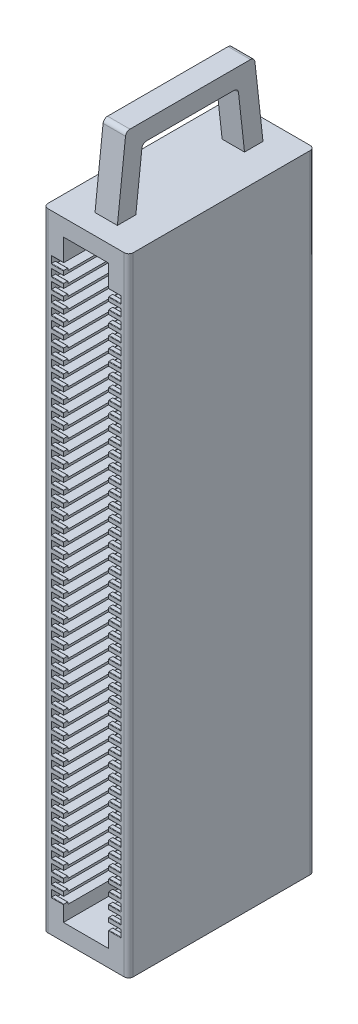
from build123d import *

# Parameters (mm, degrees)
SKETCH2_W              = 38.1
SKETCH2_H              = 83
BOSS_EXTRUDE1_DEPTH    = 140
SKETCH3_W              = 20.2
SKETCH3_H              = 265
CUT_EXTRUDE1_DEPTH     = 80.5
SKETCH4_W              = 5.43
SKETCH4_H              = 3
CUT_EXTRUDE2_DEPTH     = 80.5
SKETCH5_W              = 78.5
SKETCH5_H              = 1
CUT_EXTRUDE3_DEPTH     = 5.43
FILLET1_R              = 0.2
LPATTERN2_COUNT        = 50
LPATTERN2_PITCH        = 5
FILLET1_OF_LPATTERN2_R = 0.2
MIRROR1_START          = -15.53
MIRROR1_DEPTH          = 5.43
BOSS_EXTRUDE2_DEPTH    = 5
FILLET2_R              = 2
FILLET3_R              = 2


# Read off the part's stored shape, not the designer's step: Mirror1
with BuildPart() as part:
    # Sketch2 → Boss-Extrude1 (new, symmetric)
    with BuildSketch(Plane(origin=(0, 0, 0), x_dir=(1, 0, 0), z_dir=(0, 1, 0))):
        Rectangle(SKETCH2_W, SKETCH2_H)
    extrude(amount=BOSS_EXTRUDE1_DEPTH, both=True)

    # Sketch3 → Cut-Extrude1 (cut)
    with BuildSketch(Plane.XY.offset(41.5)):
        Rectangle(SKETCH3_W, SKETCH3_H)
    extrude(amount=-CUT_EXTRUDE1_DEPTH, mode=Mode.SUBTRACT)

    # Sketch4 → Cut-Extrude2 (cut)
    with BuildSketch(Plane.XY.offset(41.5)):
        with Locations((12.815, -124)):
            Rectangle(SKETCH4_W, SKETCH4_H)
    cut_extrude2 = extrude(amount=-CUT_EXTRUDE2_DEPTH, mode=Mode.SUBTRACT)

    # Sketch5 → Cut-Extrude3 (cut)
    with BuildSketch(Plane.ZY.offset(-10.1)):
        with Locations((0.25, -126)):
            Rectangle(SKETCH5_W, SKETCH5_H)
    cut_extrude3 = extrude(amount=-CUT_EXTRUDE3_DEPTH, mode=Mode.SUBTRACT)

    # Fillet1
    fillet1_edges = [part.edges().sort_by_distance(p)[0] for p in [
        (12.815, -125.5, 41.5),
        (12.815, -122.5, 41.5),
        (12.815, -125.5, 39.5),
    ]]
    fillet(fillet1_edges, radius=FILLET1_R)

    # LPattern2: Cut-Extrude2, Cut-Extrude3 ×50
    with Locations(*[(0, i * LPATTERN2_PITCH, 0) for i in range(1, LPATTERN2_COUNT)]):
        add(cut_extrude2, mode=Mode.SUBTRACT)
        add(cut_extrude3, mode=Mode.SUBTRACT)

    # Fillet1 of LPattern2
    fillet1_of_lpattern2_edges = [part.edges().sort_by_distance(p)[0] for p in [
        (12.815, -120.5, 41.5),
        (12.815, -117.5, 41.5),
        (12.815, -120.5, 39.5),
        (12.815, -115.5, 41.5),
        (12.815, -112.5, 41.5),
        (12.815, -115.5, 39.5),
        (12.815, -110.5, 41.5),
        (12.815, -107.5, 41.5),
        (12.815, -110.5, 39.5),
        (12.815, -105.5, 41.5),
        (12.815, -102.5, 41.5),
        (12.815, -105.5, 39.5),
        (12.815, -100.5, 41.5),
        (12.815, -97.5, 41.5),
        (12.815, -100.5, 39.5),
        (12.815, -95.5, 41.5),
        (12.815, -92.5, 41.5),
        (12.815, -95.5, 39.5),
        (12.815, -90.5, 41.5),
        (12.815, -87.5, 41.5),
        (12.815, -90.5, 39.5),
        (12.815, -85.5, 41.5),
        (12.815, -82.5, 41.5),
        (12.815, -85.5, 39.5),
        (12.815, -80.5, 41.5),
        (12.815, -77.5, 41.5),
        (12.815, -80.5, 39.5),
        (12.815, -75.5, 41.5),
        (12.815, -72.5, 41.5),
        (12.815, -75.5, 39.5),
        (12.815, -70.5, 41.5),
        (12.815, -67.5, 41.5),
        (12.815, -70.5, 39.5),
        (12.815, -65.5, 41.5),
        (12.815, -62.5, 41.5),
        (12.815, -65.5, 39.5),
        (12.815, -60.5, 41.5),
        (12.815, -57.5, 41.5),
        (12.815, -60.5, 39.5),
        (12.815, -55.5, 41.5),
        (12.815, -52.5, 41.5),
        (12.815, -55.5, 39.5),
        (12.815, -50.5, 41.5),
        (12.815, -47.5, 41.5),
        (12.815, -50.5, 39.5),
        (12.815, -45.5, 41.5),
        (12.815, -42.5, 41.5),
        (12.815, -45.5, 39.5),
        (12.815, -40.5, 41.5),
        (12.815, -37.5, 41.5),
        (12.815, -40.5, 39.5),
        (12.815, -35.5, 41.5),
        (12.815, -32.5, 41.5),
        (12.815, -35.5, 39.5),
        (12.815, -30.5, 41.5),
        (12.815, -27.5, 41.5),
        (12.815, -30.5, 39.5),
        (12.815, -25.5, 41.5),
        (12.815, -22.5, 41.5),
        (12.815, -25.5, 39.5),
        (12.815, -20.5, 41.5),
        (12.815, -17.5, 41.5),
        (12.815, -20.5, 39.5),
        (12.815, -15.5, 41.5),
        (12.815, -12.5, 41.5),
        (12.815, -15.5, 39.5),
        (12.815, -10.5, 41.5),
        (12.815, -7.5, 41.5),
        (12.815, -10.5, 39.5),
        (12.815, -5.5, 41.5),
        (12.815, -2.5, 41.5),
        (12.815, -5.5, 39.5),
        (12.815, -0.5, 41.5),
        (12.815, 2.5, 41.5),
        (12.815, -0.5, 39.5),
        (12.815, 4.5, 41.5),
        (12.815, 7.5, 41.5),
        (12.815, 4.5, 39.5),
        (12.815, 9.5, 41.5),
        (12.815, 12.5, 41.5),
        (12.815, 9.5, 39.5),
        (12.815, 14.5, 41.5),
        (12.815, 17.5, 41.5),
        (12.815, 14.5, 39.5),
        (12.815, 19.5, 41.5),
        (12.815, 22.5, 41.5),
        (12.815, 19.5, 39.5),
        (12.815, 24.5, 41.5),
        (12.815, 27.5, 41.5),
        (12.815, 24.5, 39.5),
        (12.815, 29.5, 41.5),
        (12.815, 32.5, 41.5),
        (12.815, 29.5, 39.5),
        (12.815, 34.5, 41.5),
        (12.815, 37.5, 41.5),
        (12.815, 34.5, 39.5),
        (12.815, 39.5, 41.5),
        (12.815, 42.5, 41.5),
        (12.815, 39.5, 39.5),
        (12.815, 44.5, 41.5),
        (12.815, 47.5, 41.5),
        (12.815, 44.5, 39.5),
        (12.815, 49.5, 41.5),
        (12.815, 52.5, 41.5),
        (12.815, 49.5, 39.5),
        (12.815, 54.5, 41.5),
        (12.815, 57.5, 41.5),
        (12.815, 54.5, 39.5),
        (12.815, 59.5, 41.5),
        (12.815, 62.5, 41.5),
        (12.815, 59.5, 39.5),
        (12.815, 64.5, 41.5),
        (12.815, 67.5, 41.5),
        (12.815, 64.5, 39.5),
        (12.815, 69.5, 41.5),
        (12.815, 72.5, 41.5),
        (12.815, 69.5, 39.5),
        (12.815, 74.5, 41.5),
        (12.815, 77.5, 41.5),
        (12.815, 74.5, 39.5),
        (12.815, 79.5, 41.5),
        (12.815, 82.5, 41.5),
        (12.815, 79.5, 39.5),
        (12.815, 84.5, 41.5),
        (12.815, 87.5, 41.5),
        (12.815, 84.5, 39.5),
        (12.815, 89.5, 41.5),
        (12.815, 92.5, 41.5),
        (12.815, 89.5, 39.5),
        (12.815, 94.5, 41.5),
        (12.815, 97.5, 41.5),
        (12.815, 94.5, 39.5),
        (12.815, 99.5, 41.5),
        (12.815, 102.5, 41.5),
        (12.815, 99.5, 39.5),
        (12.815, 104.5, 41.5),
        (12.815, 107.5, 41.5),
        (12.815, 104.5, 39.5),
        (12.815, 109.5, 41.5),
        (12.815, 112.5, 41.5),
        (12.815, 109.5, 39.5),
        (12.815, 114.5, 41.5),
        (12.815, 117.5, 41.5),
        (12.815, 114.5, 39.5),
        (12.815, 119.5, 41.5),
        (12.815, 122.5, 41.5),
        (12.815, 119.5, 39.5),
    ]]
    fillet(fillet1_of_lpattern2_edges, radius=FILLET1_OF_LPATTERN2_R)

    # Mirror1 outline → Mirror1 (cut)
    with BuildSketch(Plane.YZ.offset(MIRROR1_START)):
        with BuildLine():
            Line((119.5, 41.3), (119.5, 39.7))
            ThreePointArc((119.5, 39.7), (119.441421356, 39.558578644), (119.3, 39.5))
            Line((119.3, 39.5), (118.5, 39.5))
            Line((118.5, 39.5), (118.5, -39))
            Line((118.5, -39), (122.5, -39))
            Line((122.5, -39), (122.5, 41.3))
            ThreePointArc((122.5, 41.3), (122.558578644, 41.441421356), (122.7, 41.5))
            Line((122.7, 41.5), (119.3, 41.5))
            ThreePointArc((119.3, 41.5), (119.441421356, 41.441421356), (119.5, 41.3))
        make_face()
        with BuildLine():
            ThreePointArc((117.5, 41.3), (117.558578644, 41.441421356), (117.7, 41.5))
            Line((117.7, 41.5), (114.3, 41.5))
            ThreePointArc((114.3, 41.5), (114.441421356, 41.441421356), (114.5, 41.3))
            Line((114.5, 41.3), (114.5, 39.7))
            ThreePointArc((114.5, 39.7), (114.441421356, 39.558578644), (114.3, 39.5))
            Line((114.3, 39.5), (113.5, 39.5))
            Line((113.5, 39.5), (113.5, -39))
            Line((113.5, -39), (117.5, -39))
            Line((117.5, -39), (117.5, 41.3))
        make_face()
        with BuildLine():
            ThreePointArc((112.5, 41.3), (112.558578644, 41.441421356), (112.7, 41.5))
            Line((112.7, 41.5), (109.3, 41.5))
            ThreePointArc((109.3, 41.5), (109.441421356, 41.441421356), (109.5, 41.3))
            Line((109.5, 41.3), (109.5, 39.7))
            ThreePointArc((109.5, 39.7), (109.441421356, 39.558578644), (109.3, 39.5))
            Line((109.3, 39.5), (108.5, 39.5))
            Line((108.5, 39.5), (108.5, -39))
            Line((108.5, -39), (112.5, -39))
            Line((112.5, -39), (112.5, 41.3))
        make_face()
        with BuildLine():
            ThreePointArc((107.5, 41.3), (107.558578644, 41.441421356), (107.7, 41.5))
            Line((107.7, 41.5), (104.3, 41.5))
            ThreePointArc((104.3, 41.5), (104.441421356, 41.441421356), (104.5, 41.3))
            Line((104.5, 41.3), (104.5, 39.7))
            ThreePointArc((104.5, 39.7), (104.441421356, 39.558578644), (104.3, 39.5))
            Line((104.3, 39.5), (103.5, 39.5))
            Line((103.5, 39.5), (103.5, -39))
            Line((103.5, -39), (107.5, -39))
            Line((107.5, -39), (107.5, 41.3))
        make_face()
        with BuildLine():
            ThreePointArc((102.5, 41.3), (102.558578644, 41.441421356), (102.7, 41.5))
            Line((102.7, 41.5), (99.3, 41.5))
            ThreePointArc((99.3, 41.5), (99.441421356, 41.441421356), (99.5, 41.3))
            Line((99.5, 41.3), (99.5, 39.7))
            ThreePointArc((99.5, 39.7), (99.441421356, 39.558578644), (99.3, 39.5))
            Line((99.3, 39.5), (98.5, 39.5))
            Line((98.5, 39.5), (98.5, -39))
            Line((98.5, -39), (102.5, -39))
            Line((102.5, -39), (102.5, 41.3))
        make_face()
        with BuildLine():
            ThreePointArc((97.5, 41.3), (97.558578644, 41.441421356), (97.7, 41.5))
            Line((97.7, 41.5), (94.3, 41.5))
            ThreePointArc((94.3, 41.5), (94.441421356, 41.441421356), (94.5, 41.3))
            Line((94.5, 41.3), (94.5, 39.7))
            ThreePointArc((94.5, 39.7), (94.441421356, 39.558578644), (94.3, 39.5))
            Line((94.3, 39.5), (93.5, 39.5))
            Line((93.5, 39.5), (93.5, -39))
            Line((93.5, -39), (97.5, -39))
            Line((97.5, -39), (97.5, 41.3))
        make_face()
        with BuildLine():
            ThreePointArc((92.5, 41.3), (92.558578644, 41.441421356), (92.7, 41.5))
            Line((92.7, 41.5), (89.3, 41.5))
            ThreePointArc((89.3, 41.5), (89.441421356, 41.441421356), (89.5, 41.3))
            Line((89.5, 41.3), (89.5, 39.7))
            ThreePointArc((89.5, 39.7), (89.441421356, 39.558578644), (89.3, 39.5))
            Line((89.3, 39.5), (88.5, 39.5))
            Line((88.5, 39.5), (88.5, -39))
            Line((88.5, -39), (92.5, -39))
            Line((92.5, -39), (92.5, 41.3))
        make_face()
        with BuildLine():
            ThreePointArc((87.5, 41.3), (87.558578644, 41.441421356), (87.7, 41.5))
            Line((87.7, 41.5), (84.3, 41.5))
            ThreePointArc((84.3, 41.5), (84.441421356, 41.441421356), (84.5, 41.3))
            Line((84.5, 41.3), (84.5, 39.7))
            ThreePointArc((84.5, 39.7), (84.441421356, 39.558578644), (84.3, 39.5))
            Line((84.3, 39.5), (83.5, 39.5))
            Line((83.5, 39.5), (83.5, -39))
            Line((83.5, -39), (87.5, -39))
            Line((87.5, -39), (87.5, 41.3))
        make_face()
        with BuildLine():
            ThreePointArc((82.5, 41.3), (82.558578644, 41.441421356), (82.7, 41.5))
            Line((82.7, 41.5), (79.3, 41.5))
            ThreePointArc((79.3, 41.5), (79.441421356, 41.441421356), (79.5, 41.3))
            Line((79.5, 41.3), (79.5, 39.7))
            ThreePointArc((79.5, 39.7), (79.441421356, 39.558578644), (79.3, 39.5))
            Line((79.3, 39.5), (78.5, 39.5))
            Line((78.5, 39.5), (78.5, -39))
            Line((78.5, -39), (82.5, -39))
            Line((82.5, -39), (82.5, 41.3))
        make_face()
        with BuildLine():
            ThreePointArc((77.5, 41.3), (77.558578644, 41.441421356), (77.7, 41.5))
            Line((77.7, 41.5), (74.3, 41.5))
            ThreePointArc((74.3, 41.5), (74.441421356, 41.441421356), (74.5, 41.3))
            Line((74.5, 41.3), (74.5, 39.7))
            ThreePointArc((74.5, 39.7), (74.441421356, 39.558578644), (74.3, 39.5))
            Line((74.3, 39.5), (73.5, 39.5))
            Line((73.5, 39.5), (73.5, -39))
            Line((73.5, -39), (77.5, -39))
            Line((77.5, -39), (77.5, 41.3))
        make_face()
        with BuildLine():
            ThreePointArc((72.5, 41.3), (72.558578644, 41.441421356), (72.7, 41.5))
            Line((72.7, 41.5), (69.3, 41.5))
            ThreePointArc((69.3, 41.5), (69.441421356, 41.441421356), (69.5, 41.3))
            Line((69.5, 41.3), (69.5, 39.7))
            ThreePointArc((69.5, 39.7), (69.441421356, 39.558578644), (69.3, 39.5))
            Line((69.3, 39.5), (68.5, 39.5))
            Line((68.5, 39.5), (68.5, -39))
            Line((68.5, -39), (72.5, -39))
            Line((72.5, -39), (72.5, 41.3))
        make_face()
        with BuildLine():
            ThreePointArc((67.5, 41.3), (67.558578644, 41.441421356), (67.7, 41.5))
            Line((67.7, 41.5), (64.3, 41.5))
            ThreePointArc((64.3, 41.5), (64.441421356, 41.441421356), (64.5, 41.3))
            Line((64.5, 41.3), (64.5, 39.7))
            ThreePointArc((64.5, 39.7), (64.441421356, 39.558578644), (64.3, 39.5))
            Line((64.3, 39.5), (63.5, 39.5))
            Line((63.5, 39.5), (63.5, -39))
            Line((63.5, -39), (67.5, -39))
            Line((67.5, -39), (67.5, 41.3))
        make_face()
        with BuildLine():
            ThreePointArc((62.5, 41.3), (62.558578644, 41.441421356), (62.7, 41.5))
            Line((62.7, 41.5), (59.3, 41.5))
            ThreePointArc((59.3, 41.5), (59.441421356, 41.441421356), (59.5, 41.3))
            Line((59.5, 41.3), (59.5, 39.7))
            ThreePointArc((59.5, 39.7), (59.441421356, 39.558578644), (59.3, 39.5))
            Line((59.3, 39.5), (58.5, 39.5))
            Line((58.5, 39.5), (58.5, -39))
            Line((58.5, -39), (62.5, -39))
            Line((62.5, -39), (62.5, 41.3))
        make_face()
        with BuildLine():
            ThreePointArc((57.5, 41.3), (57.558578644, 41.441421356), (57.7, 41.5))
            Line((57.7, 41.5), (54.3, 41.5))
            ThreePointArc((54.3, 41.5), (54.441421356, 41.441421356), (54.5, 41.3))
            Line((54.5, 41.3), (54.5, 39.7))
            ThreePointArc((54.5, 39.7), (54.441421356, 39.558578644), (54.3, 39.5))
            Line((54.3, 39.5), (53.5, 39.5))
            Line((53.5, 39.5), (53.5, -39))
            Line((53.5, -39), (57.5, -39))
            Line((57.5, -39), (57.5, 41.3))
        make_face()
        with BuildLine():
            ThreePointArc((52.5, 41.3), (52.558578644, 41.441421356), (52.7, 41.5))
            Line((52.7, 41.5), (49.3, 41.5))
            ThreePointArc((49.3, 41.5), (49.441421356, 41.441421356), (49.5, 41.3))
            Line((49.5, 41.3), (49.5, 39.7))
            ThreePointArc((49.5, 39.7), (49.441421356, 39.558578644), (49.3, 39.5))
            Line((49.3, 39.5), (48.5, 39.5))
            Line((48.5, 39.5), (48.5, -39))
            Line((48.5, -39), (52.5, -39))
            Line((52.5, -39), (52.5, 41.3))
        make_face()
        with BuildLine():
            ThreePointArc((47.5, 41.3), (47.558578644, 41.441421356), (47.7, 41.5))
            Line((47.7, 41.5), (44.3, 41.5))
            ThreePointArc((44.3, 41.5), (44.441421356, 41.441421356), (44.5, 41.3))
            Line((44.5, 41.3), (44.5, 39.7))
            ThreePointArc((44.5, 39.7), (44.441421356, 39.558578644), (44.3, 39.5))
            Line((44.3, 39.5), (43.5, 39.5))
            Line((43.5, 39.5), (43.5, -39))
            Line((43.5, -39), (47.5, -39))
            Line((47.5, -39), (47.5, 41.3))
        make_face()
        with BuildLine():
            ThreePointArc((42.5, 41.3), (42.558578644, 41.441421356), (42.7, 41.5))
            Line((42.7, 41.5), (39.3, 41.5))
            ThreePointArc((39.3, 41.5), (39.441421356, 41.441421356), (39.5, 41.3))
            Line((39.5, 41.3), (39.5, 39.7))
            ThreePointArc((39.5, 39.7), (39.441421356, 39.558578644), (39.3, 39.5))
            Line((39.3, 39.5), (38.5, 39.5))
            Line((38.5, 39.5), (38.5, -39))
            Line((38.5, -39), (42.5, -39))
            Line((42.5, -39), (42.5, 41.3))
        make_face()
        with BuildLine():
            ThreePointArc((37.5, 41.3), (37.558578644, 41.441421356), (37.7, 41.5))
            Line((37.7, 41.5), (34.3, 41.5))
            ThreePointArc((34.3, 41.5), (34.441421356, 41.441421356), (34.5, 41.3))
            Line((34.5, 41.3), (34.5, 39.7))
            ThreePointArc((34.5, 39.7), (34.441421356, 39.558578644), (34.3, 39.5))
            Line((34.3, 39.5), (33.5, 39.5))
            Line((33.5, 39.5), (33.5, -39))
            Line((33.5, -39), (37.5, -39))
            Line((37.5, -39), (37.5, 41.3))
        make_face()
        with BuildLine():
            ThreePointArc((32.5, 41.3), (32.558578644, 41.441421356), (32.7, 41.5))
            Line((32.7, 41.5), (29.3, 41.5))
            ThreePointArc((29.3, 41.5), (29.441421356, 41.441421356), (29.5, 41.3))
            Line((29.5, 41.3), (29.5, 39.7))
            ThreePointArc((29.5, 39.7), (29.441421356, 39.558578644), (29.3, 39.5))
            Line((29.3, 39.5), (28.5, 39.5))
            Line((28.5, 39.5), (28.5, -39))
            Line((28.5, -39), (32.5, -39))
            Line((32.5, -39), (32.5, 41.3))
        make_face()
        with BuildLine():
            ThreePointArc((27.5, 41.3), (27.558578644, 41.441421356), (27.7, 41.5))
            Line((27.7, 41.5), (24.3, 41.5))
            ThreePointArc((24.3, 41.5), (24.441421356, 41.441421356), (24.5, 41.3))
            Line((24.5, 41.3), (24.5, 39.7))
            ThreePointArc((24.5, 39.7), (24.441421356, 39.558578644), (24.3, 39.5))
            Line((24.3, 39.5), (23.5, 39.5))
            Line((23.5, 39.5), (23.5, -39))
            Line((23.5, -39), (27.5, -39))
            Line((27.5, -39), (27.5, 41.3))
        make_face()
        with BuildLine():
            ThreePointArc((22.5, 41.3), (22.558578644, 41.441421356), (22.7, 41.5))
            Line((22.7, 41.5), (19.3, 41.5))
            ThreePointArc((19.3, 41.5), (19.441421356, 41.441421356), (19.5, 41.3))
            Line((19.5, 41.3), (19.5, 39.7))
            ThreePointArc((19.5, 39.7), (19.441421356, 39.558578644), (19.3, 39.5))
            Line((19.3, 39.5), (18.5, 39.5))
            Line((18.5, 39.5), (18.5, -39))
            Line((18.5, -39), (22.5, -39))
            Line((22.5, -39), (22.5, 41.3))
        make_face()
        with BuildLine():
            ThreePointArc((17.5, 41.3), (17.558578644, 41.441421356), (17.7, 41.5))
            Line((17.7, 41.5), (14.3, 41.5))
            ThreePointArc((14.3, 41.5), (14.441421356, 41.441421356), (14.5, 41.3))
            Line((14.5, 41.3), (14.5, 39.7))
            ThreePointArc((14.5, 39.7), (14.441421356, 39.558578644), (14.3, 39.5))
            Line((14.3, 39.5), (13.5, 39.5))
            Line((13.5, 39.5), (13.5, -39))
            Line((13.5, -39), (17.5, -39))
            Line((17.5, -39), (17.5, 41.3))
        make_face()
        with BuildLine():
            ThreePointArc((12.5, 41.3), (12.558578644, 41.441421356), (12.7, 41.5))
            Line((12.7, 41.5), (9.3, 41.5))
            ThreePointArc((9.3, 41.5), (9.441421356, 41.441421356), (9.5, 41.3))
            Line((9.5, 41.3), (9.5, 39.7))
            ThreePointArc((9.5, 39.7), (9.441421356, 39.558578644), (9.3, 39.5))
            Line((9.3, 39.5), (8.5, 39.5))
            Line((8.5, 39.5), (8.5, -39))
            Line((8.5, -39), (12.5, -39))
            Line((12.5, -39), (12.5, 41.3))
        make_face()
        with BuildLine():
            ThreePointArc((7.5, 41.3), (7.558578644, 41.441421356), (7.7, 41.5))
            Line((7.7, 41.5), (4.3, 41.5))
            ThreePointArc((4.3, 41.5), (4.441421356, 41.441421356), (4.5, 41.3))
            Line((4.5, 41.3), (4.5, 39.7))
            ThreePointArc((4.5, 39.7), (4.441421356, 39.558578644), (4.3, 39.5))
            Line((4.3, 39.5), (3.5, 39.5))
            Line((3.5, 39.5), (3.5, -39))
            Line((3.5, -39), (7.5, -39))
            Line((7.5, -39), (7.5, 41.3))
        make_face()
        with BuildLine():
            ThreePointArc((2.5, 41.3), (2.558578644, 41.441421356), (2.7, 41.5))
            Line((2.7, 41.5), (-0.7, 41.5))
            ThreePointArc((-0.7, 41.5), (-0.558578644, 41.441421356), (-0.5, 41.3))
            Line((-0.5, 41.3), (-0.5, 39.7))
            ThreePointArc((-0.5, 39.7), (-0.558578644, 39.558578644), (-0.7, 39.5))
            Line((-0.7, 39.5), (-1.5, 39.5))
            Line((-1.5, 39.5), (-1.5, -39))
            Line((-1.5, -39), (2.5, -39))
            Line((2.5, -39), (2.5, 41.3))
        make_face()
        with BuildLine():
            ThreePointArc((-2.5, 41.3), (-2.441421356, 41.441421356), (-2.3, 41.5))
            Line((-2.3, 41.5), (-5.7, 41.5))
            ThreePointArc((-5.7, 41.5), (-5.558578644, 41.441421356), (-5.5, 41.3))
            Line((-5.5, 41.3), (-5.5, 39.7))
            ThreePointArc((-5.5, 39.7), (-5.558578644, 39.558578644), (-5.7, 39.5))
            Line((-5.7, 39.5), (-6.5, 39.5))
            Line((-6.5, 39.5), (-6.5, -39))
            Line((-6.5, -39), (-2.5, -39))
            Line((-2.5, -39), (-2.5, 41.3))
        make_face()
        with BuildLine():
            ThreePointArc((-7.5, 41.3), (-7.441421356, 41.441421356), (-7.3, 41.5))
            Line((-7.3, 41.5), (-10.7, 41.5))
            ThreePointArc((-10.7, 41.5), (-10.558578644, 41.441421356), (-10.5, 41.3))
            Line((-10.5, 41.3), (-10.5, 39.7))
            ThreePointArc((-10.5, 39.7), (-10.558578644, 39.558578644), (-10.7, 39.5))
            Line((-10.7, 39.5), (-11.5, 39.5))
            Line((-11.5, 39.5), (-11.5, -39))
            Line((-11.5, -39), (-7.5, -39))
            Line((-7.5, -39), (-7.5, 41.3))
        make_face()
        with BuildLine():
            ThreePointArc((-12.5, 41.3), (-12.441421356, 41.441421356), (-12.3, 41.5))
            Line((-12.3, 41.5), (-15.7, 41.5))
            ThreePointArc((-15.7, 41.5), (-15.558578644, 41.441421356), (-15.5, 41.3))
            Line((-15.5, 41.3), (-15.5, 39.7))
            ThreePointArc((-15.5, 39.7), (-15.558578644, 39.558578644), (-15.7, 39.5))
            Line((-15.7, 39.5), (-16.5, 39.5))
            Line((-16.5, 39.5), (-16.5, -39))
            Line((-16.5, -39), (-12.5, -39))
            Line((-12.5, -39), (-12.5, 41.3))
        make_face()
        with BuildLine():
            ThreePointArc((-17.5, 41.3), (-17.441421356, 41.441421356), (-17.3, 41.5))
            Line((-17.3, 41.5), (-20.7, 41.5))
            ThreePointArc((-20.7, 41.5), (-20.558578644, 41.441421356), (-20.5, 41.3))
            Line((-20.5, 41.3), (-20.5, 39.7))
            ThreePointArc((-20.5, 39.7), (-20.558578644, 39.558578644), (-20.7, 39.5))
            Line((-20.7, 39.5), (-21.5, 39.5))
            Line((-21.5, 39.5), (-21.5, -39))
            Line((-21.5, -39), (-17.5, -39))
            Line((-17.5, -39), (-17.5, 41.3))
        make_face()
        with BuildLine():
            ThreePointArc((-22.5, 41.3), (-22.441421356, 41.441421356), (-22.3, 41.5))
            Line((-22.3, 41.5), (-25.7, 41.5))
            ThreePointArc((-25.7, 41.5), (-25.558578644, 41.441421356), (-25.5, 41.3))
            Line((-25.5, 41.3), (-25.5, 39.7))
            ThreePointArc((-25.5, 39.7), (-25.558578644, 39.558578644), (-25.7, 39.5))
            Line((-25.7, 39.5), (-26.5, 39.5))
            Line((-26.5, 39.5), (-26.5, -39))
            Line((-26.5, -39), (-22.5, -39))
            Line((-22.5, -39), (-22.5, 41.3))
        make_face()
        with BuildLine():
            ThreePointArc((-27.5, 41.3), (-27.441421356, 41.441421356), (-27.3, 41.5))
            Line((-27.3, 41.5), (-30.7, 41.5))
            ThreePointArc((-30.7, 41.5), (-30.558578644, 41.441421356), (-30.5, 41.3))
            Line((-30.5, 41.3), (-30.5, 39.7))
            ThreePointArc((-30.5, 39.7), (-30.558578644, 39.558578644), (-30.7, 39.5))
            Line((-30.7, 39.5), (-31.5, 39.5))
            Line((-31.5, 39.5), (-31.5, -39))
            Line((-31.5, -39), (-27.5, -39))
            Line((-27.5, -39), (-27.5, 41.3))
        make_face()
        with BuildLine():
            ThreePointArc((-32.5, 41.3), (-32.441421356, 41.441421356), (-32.3, 41.5))
            Line((-32.3, 41.5), (-35.7, 41.5))
            ThreePointArc((-35.7, 41.5), (-35.558578644, 41.441421356), (-35.5, 41.3))
            Line((-35.5, 41.3), (-35.5, 39.7))
            ThreePointArc((-35.5, 39.7), (-35.558578644, 39.558578644), (-35.7, 39.5))
            Line((-35.7, 39.5), (-36.5, 39.5))
            Line((-36.5, 39.5), (-36.5, -39))
            Line((-36.5, -39), (-32.5, -39))
            Line((-32.5, -39), (-32.5, 41.3))
        make_face()
        with BuildLine():
            ThreePointArc((-37.5, 41.3), (-37.441421356, 41.441421356), (-37.3, 41.5))
            Line((-37.3, 41.5), (-40.7, 41.5))
            ThreePointArc((-40.7, 41.5), (-40.558578644, 41.441421356), (-40.5, 41.3))
            Line((-40.5, 41.3), (-40.5, 39.7))
            ThreePointArc((-40.5, 39.7), (-40.558578644, 39.558578644), (-40.7, 39.5))
            Line((-40.7, 39.5), (-41.5, 39.5))
            Line((-41.5, 39.5), (-41.5, -39))
            Line((-41.5, -39), (-37.5, -39))
            Line((-37.5, -39), (-37.5, 41.3))
        make_face()
        with BuildLine():
            ThreePointArc((-42.5, 41.3), (-42.441421356, 41.441421356), (-42.3, 41.5))
            Line((-42.3, 41.5), (-45.7, 41.5))
            ThreePointArc((-45.7, 41.5), (-45.558578644, 41.441421356), (-45.5, 41.3))
            Line((-45.5, 41.3), (-45.5, 39.7))
            ThreePointArc((-45.5, 39.7), (-45.558578644, 39.558578644), (-45.7, 39.5))
            Line((-45.7, 39.5), (-46.5, 39.5))
            Line((-46.5, 39.5), (-46.5, -39))
            Line((-46.5, -39), (-42.5, -39))
            Line((-42.5, -39), (-42.5, 41.3))
        make_face()
        with BuildLine():
            ThreePointArc((-47.5, 41.3), (-47.441421356, 41.441421356), (-47.3, 41.5))
            Line((-47.3, 41.5), (-50.7, 41.5))
            ThreePointArc((-50.7, 41.5), (-50.558578644, 41.441421356), (-50.5, 41.3))
            Line((-50.5, 41.3), (-50.5, 39.7))
            ThreePointArc((-50.5, 39.7), (-50.558578644, 39.558578644), (-50.7, 39.5))
            Line((-50.7, 39.5), (-51.5, 39.5))
            Line((-51.5, 39.5), (-51.5, -39))
            Line((-51.5, -39), (-47.5, -39))
            Line((-47.5, -39), (-47.5, 41.3))
        make_face()
        with BuildLine():
            ThreePointArc((-52.5, 41.3), (-52.441421356, 41.441421356), (-52.3, 41.5))
            Line((-52.3, 41.5), (-55.7, 41.5))
            ThreePointArc((-55.7, 41.5), (-55.558578644, 41.441421356), (-55.5, 41.3))
            Line((-55.5, 41.3), (-55.5, 39.7))
            ThreePointArc((-55.5, 39.7), (-55.558578644, 39.558578644), (-55.7, 39.5))
            Line((-55.7, 39.5), (-56.5, 39.5))
            Line((-56.5, 39.5), (-56.5, -39))
            Line((-56.5, -39), (-52.5, -39))
            Line((-52.5, -39), (-52.5, 41.3))
        make_face()
        with BuildLine():
            ThreePointArc((-57.5, 41.3), (-57.441421356, 41.441421356), (-57.3, 41.5))
            Line((-57.3, 41.5), (-60.7, 41.5))
            ThreePointArc((-60.7, 41.5), (-60.558578644, 41.441421356), (-60.5, 41.3))
            Line((-60.5, 41.3), (-60.5, 39.7))
            ThreePointArc((-60.5, 39.7), (-60.558578644, 39.558578644), (-60.7, 39.5))
            Line((-60.7, 39.5), (-61.5, 39.5))
            Line((-61.5, 39.5), (-61.5, -39))
            Line((-61.5, -39), (-57.5, -39))
            Line((-57.5, -39), (-57.5, 41.3))
        make_face()
        with BuildLine():
            ThreePointArc((-62.5, 41.3), (-62.441421356, 41.441421356), (-62.3, 41.5))
            Line((-62.3, 41.5), (-65.7, 41.5))
            ThreePointArc((-65.7, 41.5), (-65.558578644, 41.441421356), (-65.5, 41.3))
            Line((-65.5, 41.3), (-65.5, 39.7))
            ThreePointArc((-65.5, 39.7), (-65.558578644, 39.558578644), (-65.7, 39.5))
            Line((-65.7, 39.5), (-66.5, 39.5))
            Line((-66.5, 39.5), (-66.5, -39))
            Line((-66.5, -39), (-62.5, -39))
            Line((-62.5, -39), (-62.5, 41.3))
        make_face()
        with BuildLine():
            ThreePointArc((-67.5, 41.3), (-67.441421356, 41.441421356), (-67.3, 41.5))
            Line((-67.3, 41.5), (-70.7, 41.5))
            ThreePointArc((-70.7, 41.5), (-70.558578644, 41.441421356), (-70.5, 41.3))
            Line((-70.5, 41.3), (-70.5, 39.7))
            ThreePointArc((-70.5, 39.7), (-70.558578644, 39.558578644), (-70.7, 39.5))
            Line((-70.7, 39.5), (-71.5, 39.5))
            Line((-71.5, 39.5), (-71.5, -39))
            Line((-71.5, -39), (-67.5, -39))
            Line((-67.5, -39), (-67.5, 41.3))
        make_face()
        with BuildLine():
            ThreePointArc((-72.5, 41.3), (-72.441421356, 41.441421356), (-72.3, 41.5))
            Line((-72.3, 41.5), (-75.7, 41.5))
            ThreePointArc((-75.7, 41.5), (-75.558578644, 41.441421356), (-75.5, 41.3))
            Line((-75.5, 41.3), (-75.5, 39.7))
            ThreePointArc((-75.5, 39.7), (-75.558578644, 39.558578644), (-75.7, 39.5))
            Line((-75.7, 39.5), (-76.5, 39.5))
            Line((-76.5, 39.5), (-76.5, -39))
            Line((-76.5, -39), (-72.5, -39))
            Line((-72.5, -39), (-72.5, 41.3))
        make_face()
        with BuildLine():
            ThreePointArc((-77.5, 41.3), (-77.441421356, 41.441421356), (-77.3, 41.5))
            Line((-77.3, 41.5), (-80.7, 41.5))
            ThreePointArc((-80.7, 41.5), (-80.558578644, 41.441421356), (-80.5, 41.3))
            Line((-80.5, 41.3), (-80.5, 39.7))
            ThreePointArc((-80.5, 39.7), (-80.558578644, 39.558578644), (-80.7, 39.5))
            Line((-80.7, 39.5), (-81.5, 39.5))
            Line((-81.5, 39.5), (-81.5, -39))
            Line((-81.5, -39), (-77.5, -39))
            Line((-77.5, -39), (-77.5, 41.3))
        make_face()
        with BuildLine():
            ThreePointArc((-82.5, 41.3), (-82.441421356, 41.441421356), (-82.3, 41.5))
            Line((-82.3, 41.5), (-85.7, 41.5))
            ThreePointArc((-85.7, 41.5), (-85.558578644, 41.441421356), (-85.5, 41.3))
            Line((-85.5, 41.3), (-85.5, 39.7))
            ThreePointArc((-85.5, 39.7), (-85.558578644, 39.558578644), (-85.7, 39.5))
            Line((-85.7, 39.5), (-86.5, 39.5))
            Line((-86.5, 39.5), (-86.5, -39))
            Line((-86.5, -39), (-82.5, -39))
            Line((-82.5, -39), (-82.5, 41.3))
        make_face()
        with BuildLine():
            ThreePointArc((-87.5, 41.3), (-87.441421356, 41.441421356), (-87.3, 41.5))
            Line((-87.3, 41.5), (-90.7, 41.5))
            ThreePointArc((-90.7, 41.5), (-90.558578644, 41.441421356), (-90.5, 41.3))
            Line((-90.5, 41.3), (-90.5, 39.7))
            ThreePointArc((-90.5, 39.7), (-90.558578644, 39.558578644), (-90.7, 39.5))
            Line((-90.7, 39.5), (-91.5, 39.5))
            Line((-91.5, 39.5), (-91.5, -39))
            Line((-91.5, -39), (-87.5, -39))
            Line((-87.5, -39), (-87.5, 41.3))
        make_face()
        with BuildLine():
            ThreePointArc((-92.5, 41.3), (-92.441421356, 41.441421356), (-92.3, 41.5))
            Line((-92.3, 41.5), (-95.7, 41.5))
            ThreePointArc((-95.7, 41.5), (-95.558578644, 41.441421356), (-95.5, 41.3))
            Line((-95.5, 41.3), (-95.5, 39.7))
            ThreePointArc((-95.5, 39.7), (-95.558578644, 39.558578644), (-95.7, 39.5))
            Line((-95.7, 39.5), (-96.5, 39.5))
            Line((-96.5, 39.5), (-96.5, -39))
            Line((-96.5, -39), (-92.5, -39))
            Line((-92.5, -39), (-92.5, 41.3))
        make_face()
        with BuildLine():
            ThreePointArc((-97.5, 41.3), (-97.441421356, 41.441421356), (-97.3, 41.5))
            Line((-97.3, 41.5), (-100.7, 41.5))
            ThreePointArc((-100.7, 41.5), (-100.558578644, 41.441421356), (-100.5, 41.3))
            Line((-100.5, 41.3), (-100.5, 39.7))
            ThreePointArc((-100.5, 39.7), (-100.558578644, 39.558578644), (-100.7, 39.5))
            Line((-100.7, 39.5), (-101.5, 39.5))
            Line((-101.5, 39.5), (-101.5, -39))
            Line((-101.5, -39), (-97.5, -39))
            Line((-97.5, -39), (-97.5, 41.3))
        make_face()
        with BuildLine():
            ThreePointArc((-102.5, 41.3), (-102.441421356, 41.441421356), (-102.3, 41.5))
            Line((-102.3, 41.5), (-105.7, 41.5))
            ThreePointArc((-105.7, 41.5), (-105.558578644, 41.441421356), (-105.5, 41.3))
            Line((-105.5, 41.3), (-105.5, 39.7))
            ThreePointArc((-105.5, 39.7), (-105.558578644, 39.558578644), (-105.7, 39.5))
            Line((-105.7, 39.5), (-106.5, 39.5))
            Line((-106.5, 39.5), (-106.5, -39))
            Line((-106.5, -39), (-102.5, -39))
            Line((-102.5, -39), (-102.5, 41.3))
        make_face()
        with BuildLine():
            ThreePointArc((-107.5, 41.3), (-107.441421356, 41.441421356), (-107.3, 41.5))
            Line((-107.3, 41.5), (-110.7, 41.5))
            ThreePointArc((-110.7, 41.5), (-110.558578644, 41.441421356), (-110.5, 41.3))
            Line((-110.5, 41.3), (-110.5, 39.7))
            ThreePointArc((-110.5, 39.7), (-110.558578644, 39.558578644), (-110.7, 39.5))
            Line((-110.7, 39.5), (-111.5, 39.5))
            Line((-111.5, 39.5), (-111.5, -39))
            Line((-111.5, -39), (-107.5, -39))
            Line((-107.5, -39), (-107.5, 41.3))
        make_face()
        with BuildLine():
            ThreePointArc((-112.5, 41.3), (-112.441421356, 41.441421356), (-112.3, 41.5))
            Line((-112.3, 41.5), (-115.7, 41.5))
            ThreePointArc((-115.7, 41.5), (-115.558578644, 41.441421356), (-115.5, 41.3))
            Line((-115.5, 41.3), (-115.5, 39.7))
            ThreePointArc((-115.5, 39.7), (-115.558578644, 39.558578644), (-115.7, 39.5))
            Line((-115.7, 39.5), (-116.5, 39.5))
            Line((-116.5, 39.5), (-116.5, -39))
            Line((-116.5, -39), (-112.5, -39))
            Line((-112.5, -39), (-112.5, 41.3))
        make_face()
        with BuildLine():
            ThreePointArc((-117.5, 41.3), (-117.441421356, 41.441421356), (-117.3, 41.5))
            Line((-117.3, 41.5), (-120.7, 41.5))
            ThreePointArc((-120.7, 41.5), (-120.558578644, 41.441421356), (-120.5, 41.3))
            Line((-120.5, 41.3), (-120.5, 39.7))
            ThreePointArc((-120.5, 39.7), (-120.558578644, 39.558578644), (-120.7, 39.5))
            Line((-120.7, 39.5), (-121.5, 39.5))
            Line((-121.5, 39.5), (-121.5, -39))
            Line((-121.5, -39), (-117.5, -39))
            Line((-117.5, -39), (-117.5, 41.3))
        make_face()
        with BuildLine():
            ThreePointArc((-122.5, 41.3), (-122.441421356, 41.441421356), (-122.3, 41.5))
            Line((-122.3, 41.5), (-125.7, 41.5))
            ThreePointArc((-125.7, 41.5), (-125.558578644, 41.441421356), (-125.5, 41.3))
            Line((-125.5, 41.3), (-125.5, 39.7))
            ThreePointArc((-125.5, 39.7), (-125.558578644, 39.558578644), (-125.7, 39.5))
            Line((-125.7, 39.5), (-126.5, 39.5))
            Line((-126.5, 39.5), (-126.5, -39))
            Line((-126.5, -39), (-122.5, -39))
            Line((-122.5, -39), (-122.5, 41.3))
        make_face()
    extrude(amount=MIRROR1_DEPTH, mode=Mode.SUBTRACT)

    # Sketch6 → Boss-Extrude2 (add, symmetric)
    with BuildSketch(Plane(origin=(0, 0, 0), x_dir=(0, 0, -1), z_dir=(1, 0, 0))):
        Polygon((-32.5, 140), (-24.25, 140), (-21.352286846, 166.2), (21.352286846, 166.2), (24.25, 140), (32.5, 140), (28.689839002, 174.45), (-28.689839002, 174.45), align=None)
    extrude(amount=BOSS_EXTRUDE2_DEPTH, both=True)

    # Fillet2
    fillet2_edges = [part.edges().sort_by_distance(p)[0] for p in [
        (0, 174.45, 28.689839002),
        (0, 166.2, 21.352286846),
        (0, 166.2, -21.352286846),
        (0, 174.45, -28.689839002),
    ]]
    fillet(fillet2_edges, radius=FILLET2_R)

    # Fillet3
    fillet3_edges = [part.edges().sort_by_distance(p)[0] for p in [
        (19.05, 0, 41.5),
        (-19.05, 0, 41.5),
        (-19.05, 0, -41.5),
        (19.05, 0, -41.5),
    ]]
    fillet(fillet3_edges, radius=FILLET3_R)


solid = part.part
